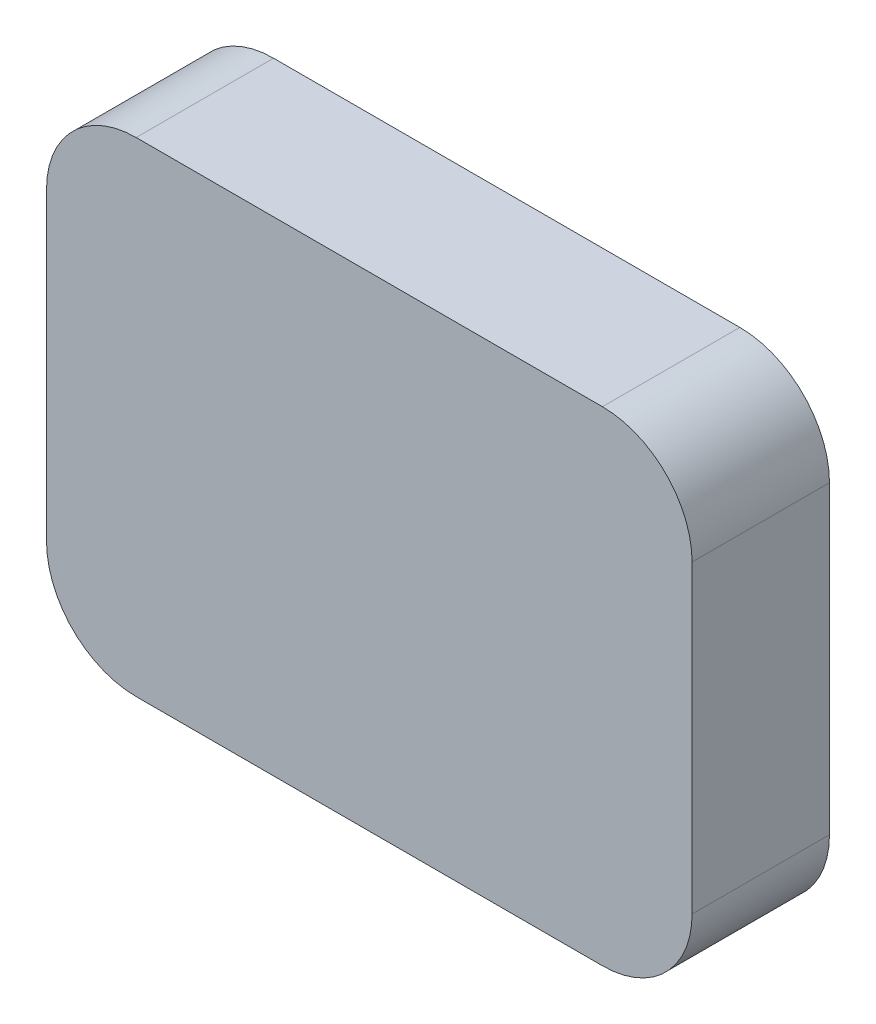
from build123d import *

# Parameters (mm, degrees)
BOSS_EXTRU_1_DEPTH = 1.2
CONG_1_R           = 2


with BuildPart() as part:
    # Balayage1: sweep along a path in Esquisse1
    with BuildLine(Plane.XY) as balayage1_path:
        Line((-26, 27), (26, 27))
        ThreePointArc((26, 27), (33.071067812, 24.071067812), (36, 17))
        Line((36, 17), (36, -17))
        ThreePointArc((36, -17), (33.071067812, -24.071067812), (26, -27))
        Line((26, -27), (-26, -27))
        ThreePointArc((-26, -27), (-33.071067812, -24.071067812), (-36, -17))
        Line((-36, -17), (-36, 17))
        ThreePointArc((-36, 17), (-33.071067812, 24.071067812), (-26, 27))
    # profil → Balayage1 (sweep)
    with BuildSketch(Plane(origin=(0, 0, 0), x_dir=(0, 0, -1), z_dir=(1, 0, 0))):
        with BuildLine():
            Line((0, -24.9), (4.139133187, -24.9))
            Line((4.139133187, -24.9), (14.1228, -20.8))
            Line((14.1228, -20.8), (14.1228, -22.9))
            ThreePointArc((14.1228, -22.9), (15.1228, -23.9), (14.1228, -24.9))
            Line((14.1228, -24.9), (14.1228, -27))
            Line((14.1228, -27), (0, -27))
            Line((0, -27), (0, -24.9))
        make_face()
    sweep(path=balayage1_path.line)

    # Esquisse1<3> → Boss.-Extru.1 (add)
    with BuildSketch(Plane.XY):
        with BuildLine():
            Line((-26, 27), (26, 27))
            ThreePointArc((26, 27), (33.071067812, 24.071067812), (36, 17))
            Line((36, 17), (36, -17))
            ThreePointArc((36, -17), (33.071067812, -24.071067812), (26, -27))
            Line((26, -27), (-26, -27))
            ThreePointArc((-26, -27), (-33.071067812, -24.071067812), (-36, -17))
            Line((-36, -17), (-36, 17))
            ThreePointArc((-36, 17), (-33.071067812, 24.071067812), (-26, 27))
        make_face()
    extrude(amount=BOSS_EXTRU_1_DEPTH)

    # Congé1
    cong_1_edges = [part.edges().sort_by_distance(p)[0] for p in [
        (-31.586143571, 22.586143571, 0),
        (-33.9, 0, 0),
        (-31.586143571, -22.586143571, 0),
        (0, -24.9, 0),
        (0, -24.9, 0),
        (31.586143571, -22.586143571, 0),
        (33.9, 0, 0),
        (31.586143571, 22.586143571, 0),
        (0, 24.9, 0),
    ]]
    fillet(cong_1_edges, radius=CONG_1_R)


solid = part.part
